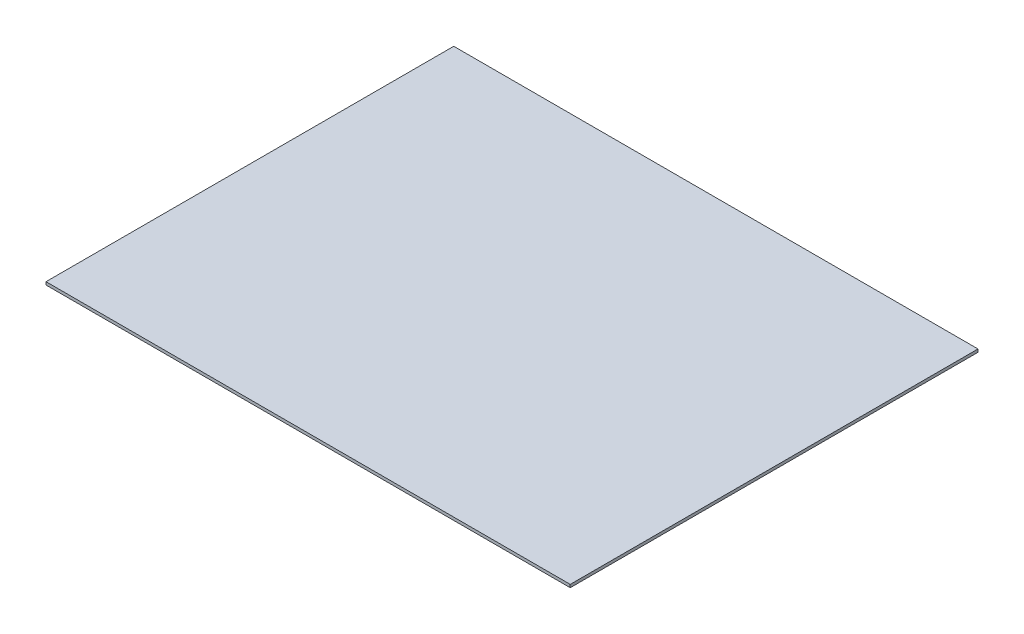
from build123d import *

# Parameters (mm, degrees)
SKETCH1_W           = 180
SKETCH1_H           = 140
BOSS_EXTRUDE1_DEPTH = 1


with BuildPart() as part:
    # Sketch1 → Boss-Extrude1 (new body)
    with BuildSketch(Plane(origin=(0, 0, 0), x_dir=(1, 0, 0), z_dir=(0, 1, 0))):
        Rectangle(SKETCH1_W, SKETCH1_H)
    extrude(amount=BOSS_EXTRUDE1_DEPTH)


solid = part.part
